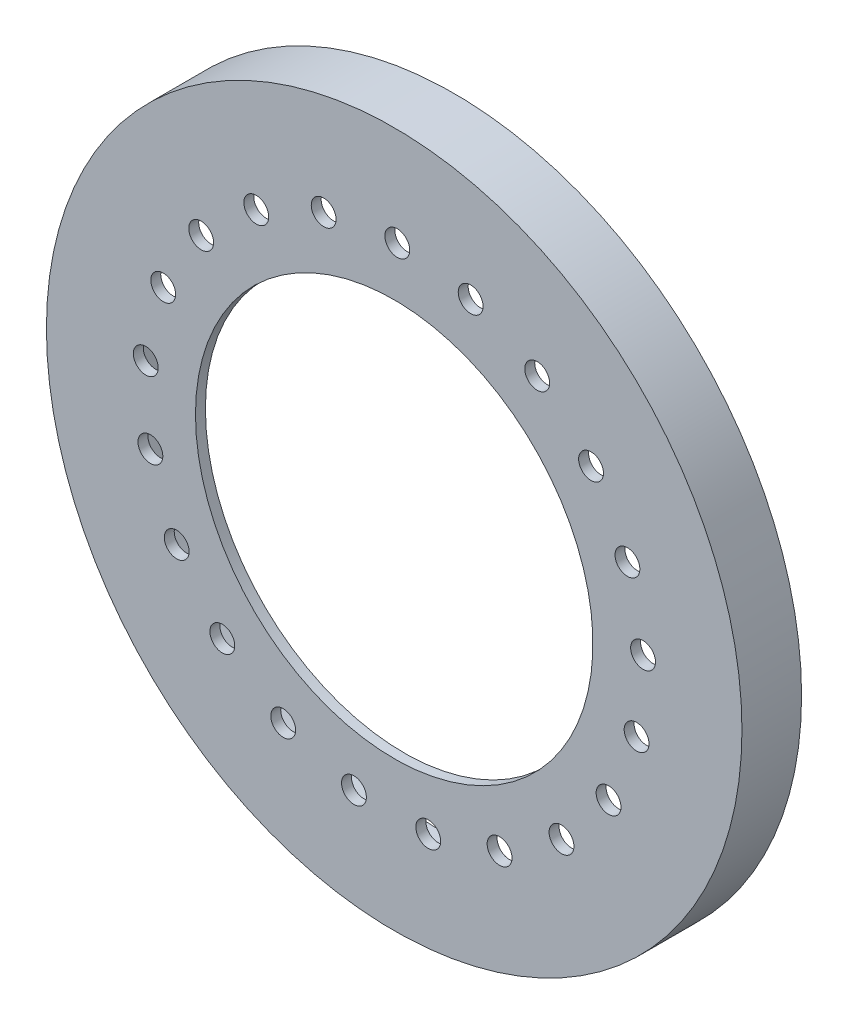
from build123d import *

# Parameters (mm, degrees)
SKETCH3_R           = 88.9
BOSS_EXTRUDE2_DEPTH = 15.24
SKETCH1_R           = 76.2
SKETCH1_R_2         = 50.8
CUT_EXTRUDE1_DEPTH  = 12.7
SKETCH4_R           = 3.175
SKETCH4_R_2         = 50.8
CUT_EXTRUDE3_DEPTH  = 127.643900761


with BuildPart() as part:
    # Sketch3 → Boss-Extrude2 (new body)
    with BuildSketch(Plane.XY):
        Circle(SKETCH3_R)
    extrude(amount=BOSS_EXTRUDE2_DEPTH)

    # Sketch1 → Cut-Extrude1 (cut)
    with BuildSketch(Plane.XY):
        Circle(SKETCH1_R)
        Circle(SKETCH1_R_2, mode=Mode.SUBTRACT)
    extrude(amount=CUT_EXTRUDE1_DEPTH, mode=Mode.SUBTRACT)

    # Sketch4 → Cut-Extrude3 (cut, through all)
    with BuildSketch(Plane.XY):
        with Locations((-63.5, 5.553714315)):
            Circle(SKETCH4_R)
        with Locations((-59.041887136, 24.023931945)):
            Circle(SKETCH4_R)
        with Locations((-49.337643499, 40.359517795)):
            Circle(SKETCH4_R)
        with Locations((-35.249533722, 53.108983374)):
            Circle(SKETCH4_R)
        with Locations((-18.029348184, 61.139482716)):
            Circle(SKETCH4_R)
        with Locations((0.79282406, 63.737470711)):
            Circle(SKETCH4_R)
        with Locations((19.544550408, 60.672104727)):
            Circle(SKETCH4_R)
        with Locations((36.559657682, 52.215755983)):
            Circle(SKETCH4_R)
        with Locations((50.326278931, 39.119808174)):
            Circle(SKETCH4_R)
        with Locations((59.621189445, 22.547893735)):
            Circle(SKETCH4_R)
        with Locations((63.618495632, 3.972499988)):
            Circle(SKETCH4_R)
        with Locations((61.963019298, -14.955867817)):
            Circle(SKETCH4_R)
        with Locations((54.801856779, -32.555341133)):
            Circle(SKETCH4_R)
        with Locations((42.771308791, -47.262129522)):
            Circle(SKETCH4_R)
        with Locations((26.940342318, -57.769470298)):
            Circle(SKETCH4_R)
        with Locations((8.715608205, -63.14374012)):
            Circle(SKETCH4_R)
        with Locations((-10.283545946, -62.907411531)):
            Circle(SKETCH4_R)
        with Locations((-28.36896191, -57.081483362)):
            Circle(SKETCH4_R)
        with Locations((-43.933671114, -46.183614899)):
            Circle(SKETCH4_R)
        with Locations((-55.594680839, -31.182129579)):
            Circle(SKETCH4_R)
        with Locations((-62.315859199, -13.409975205)):
            Circle(SKETCH4_R)
        Circle(SKETCH4_R_2)
    extrude(amount=CUT_EXTRUDE3_DEPTH, mode=Mode.SUBTRACT)


solid = part.part
